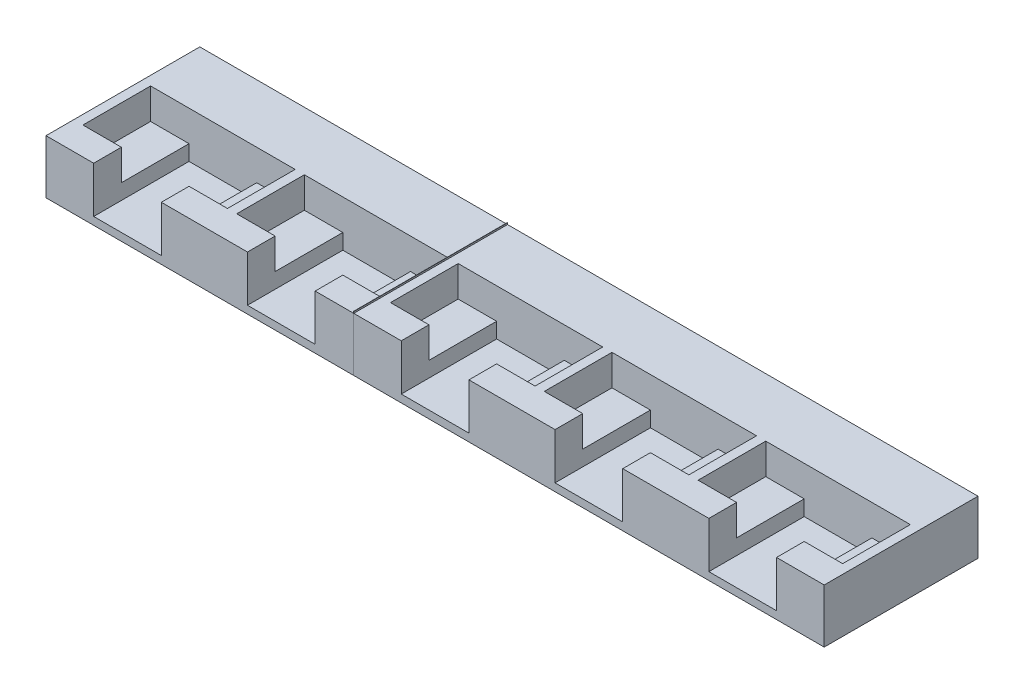
from build123d import *

# Parameters (mm, degrees)
SKETCH1_W               = 253
SKETCH1_H               = 50
BOSS_EXTRUDE1_DEPTH     = 17.5
SKETCH2_W               = 47
SKETCH2_H               = 22
CUT_EXTRUDE1_DEPTH      = 10
SKETCH4_W               = 22
SKETCH4_H               = 31
CUT_EXTRUDE2_DEPTH      = 15
MIRROR2_COPY_1_SKETCH_W = 47
MIRROR2_COPY_1_SKETCH_H = 22
MIRROR2_COPY_1_DEPTH    = 10
MIRROR2_COPY_2_SKETCH_W = 22
MIRROR2_COPY_2_SKETCH_H = 31
MIRROR2_COPY_2_DEPTH    = 15
MIRROR2_COPY_3_SKETCH_W = 47
MIRROR2_COPY_3_SKETCH_H = 22
MIRROR2_COPY_3_DEPTH    = 10
MIRROR2_COPY_4_SKETCH_W = 22
MIRROR2_COPY_4_SKETCH_H = 31
MIRROR2_COPY_4_DEPTH    = 15
SKETCH5_W               = 50
SKETCH5_H               = 18
BOSS_EXTRUDE2_DEPTH     = 0.05


with BuildPart() as part:
    # Sketch1 → Boss-Extrude1 (new body)
    with BuildSketch(Plane(origin=(0, 0, 0), x_dir=(1, 0, 0), z_dir=(0, 1, 0))):
        with Locations((126.5, -10)):
            Rectangle(SKETCH1_W, SKETCH1_H)
    extrude(amount=BOSS_EXTRUDE1_DEPTH)

    # Sketch2 → Cut-Extrude1 (cut)
    with BuildSketch(Plane(origin=(0, 17.5, 0), x_dir=(1, 0, 0), z_dir=(0, 1, 0))):
        with Locations((26.5, -15)):
            Rectangle(SKETCH2_W, SKETCH2_H)
    cut_extrude1 = extrude(amount=-CUT_EXTRUDE1_DEPTH, mode=Mode.SUBTRACT)

    # Sketch4 → Cut-Extrude2 (cut)
    with BuildSketch(Plane(origin=(0, 17.5, 0), x_dir=(1, 0, 0), z_dir=(0, 1, 0))):
        with Locations((26.5, -19.5)):
            Rectangle(SKETCH4_W, SKETCH4_H)
    cut_extrude2 = extrude(amount=-CUT_EXTRUDE2_DEPTH, mode=Mode.SUBTRACT)

    # Mirror1: Cut-Extrude1, Cut-Extrude2 across plane
    add(cut_extrude1.mirror(Plane.ZY.offset(-51.5)), mode=Mode.SUBTRACT)
    add(cut_extrude2.mirror(Plane.ZY.offset(-51.5)), mode=Mode.SUBTRACT)

    # Mirror2 copy 1 sketch → Mirror2 copy 1 (cut)
    with BuildSketch(Plane(origin=(100, 17.5, 0), x_dir=(1, 0, 0), z_dir=(0, 1, 0))):
        with Locations((26.5, -15)):
            Rectangle(MIRROR2_COPY_1_SKETCH_W, MIRROR2_COPY_1_SKETCH_H)
    extrude(amount=-MIRROR2_COPY_1_DEPTH, mode=Mode.SUBTRACT)

    # Mirror2 copy 2 sketch → Mirror2 copy 2 (cut)
    with BuildSketch(Plane(origin=(100, 17.5, 0), x_dir=(1, 0, 0), z_dir=(0, 1, 0))):
        with Locations((26.5, -19.5)):
            Rectangle(MIRROR2_COPY_2_SKETCH_W, MIRROR2_COPY_2_SKETCH_H)
    extrude(amount=-MIRROR2_COPY_2_DEPTH, mode=Mode.SUBTRACT)

    # Mirror2 copy 3 sketch → Mirror2 copy 3 (cut)
    with BuildSketch(Plane(origin=(203, 17.5, 0), x_dir=(-1, 0, 0), z_dir=(0, 1, 0))):
        with Locations((26.5, 15)):
            Rectangle(MIRROR2_COPY_3_SKETCH_W, MIRROR2_COPY_3_SKETCH_H)
    extrude(amount=-MIRROR2_COPY_3_DEPTH, mode=Mode.SUBTRACT)

    # Mirror2 copy 4 sketch → Mirror2 copy 4 (cut)
    with BuildSketch(Plane(origin=(203, 17.5, 0), x_dir=(-1, 0, 0), z_dir=(0, 1, 0))):
        with Locations((26.5, 19.5)):
            Rectangle(MIRROR2_COPY_4_SKETCH_W, MIRROR2_COPY_4_SKETCH_H)
    extrude(amount=-MIRROR2_COPY_4_DEPTH, mode=Mode.SUBTRACT)

    # Mirror3: Cut-Extrude1, Cut-Extrude2 across plane
    add(cut_extrude1.mirror(Plane.ZY.offset(-126.5)), mode=Mode.SUBTRACT)
    add(cut_extrude2.mirror(Plane.ZY.offset(-126.5)), mode=Mode.SUBTRACT)

    # Sketch5 → Boss-Extrude2 (add, symmetric)
    with BuildSketch(Plane.ZY.offset(-100)):
        with Locations((10, 9)):
            Rectangle(SKETCH5_W, SKETCH5_H)
    extrude(amount=BOSS_EXTRUDE2_DEPTH, both=True)


with BuildPart() as body_2:
    # Split1: the piece on the far side of the plane
    add(part.part)
    split(bisect_by=Plane(origin=(100.05, 0, 0), x_dir=(0, 0, -1), z_dir=(-1, 0, 0)), keep=Keep.BOTTOM)


with BuildPart() as part_1:
    add(part.part)

    # Split1
    split(bisect_by=Plane(origin=(100.05, 0, 0), x_dir=(0, 0, -1), z_dir=(-1, 0, 0)), keep=Keep.TOP)


solid = Compound([body_2.part, part_1.part])
